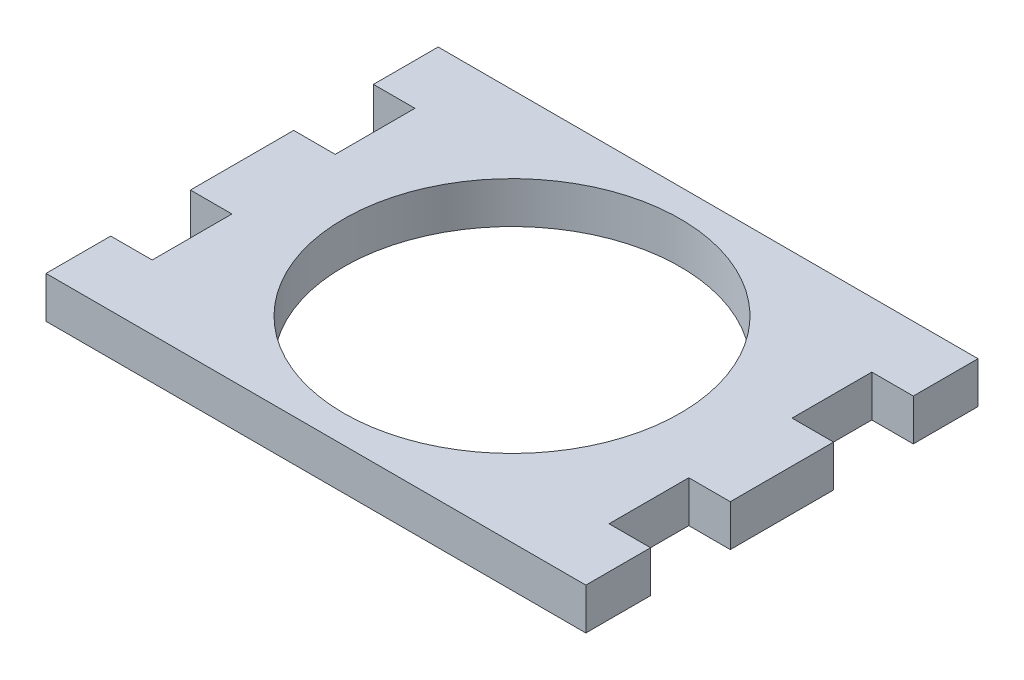
from build123d import *

# Parameters (mm, degrees)
SKETCH1_R           = 12.875
BOSS_EXTRUDE1_DEPTH = 3.175


with BuildPart() as part:
    # Sketch1 → Boss-Extrude1 (new body)
    with BuildSketch(Plane(origin=(0, 0, 0), x_dir=(1, 0, 0), z_dir=(0, 1, 0))):
        Polygon((-20.65, 15), (20.65, 15), (20.65, 10.05), (17.475, 10.05), (17.475, 3.95), (20.65, 3.95), (20.65, -3.95), (17.475, -3.95), (17.475, -10.05), (20.65, -10.05), (20.65, -15), (-20.65, -15), (-20.65, -10.05), (-17.475, -10.05), (-17.475, -3.95), (-20.65, -3.95), (-20.65, 3.95), (-17.475, 3.95), (-17.475, 10.05), (-20.65, 10.05), align=None)
        Circle(SKETCH1_R, mode=Mode.SUBTRACT)
    extrude(amount=BOSS_EXTRUDE1_DEPTH)


solid = part.part
